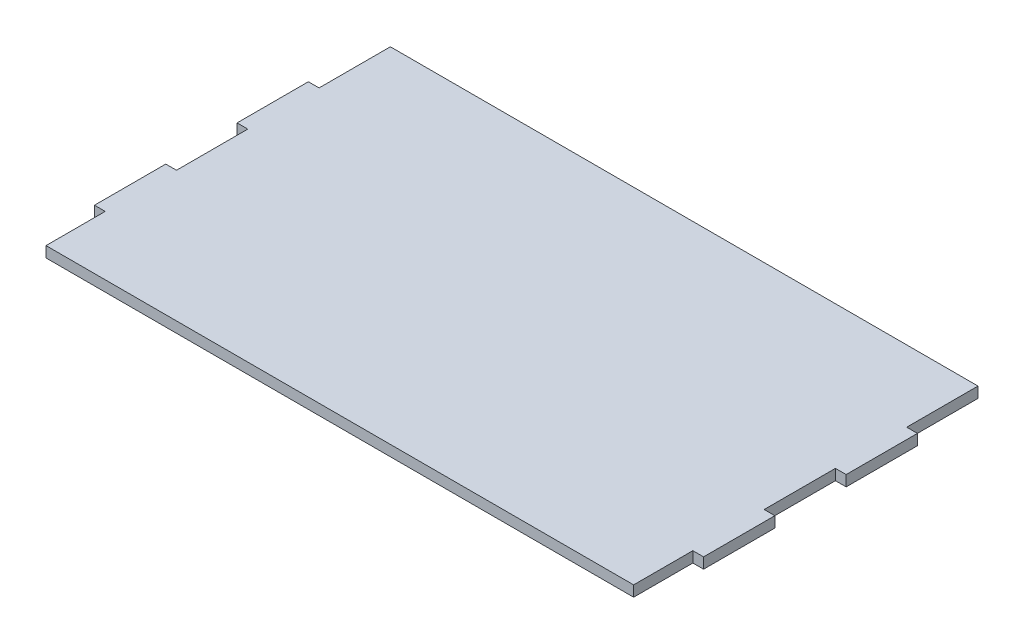
from build123d import *

# Parameters (mm, degrees)
BOSS_EXTRUDE1_DEPTH = 2.7


with BuildPart() as part:
    # Sketch2 → Boss-Extrude1 (new body)
    with BuildSketch(Plane(origin=(0, 0, 0), x_dir=(1, 0, 0), z_dir=(0, 1, 0))):
        Polygon((-76.7, -26.931), (-76.7, -8.977), (-74, -8.977), (-74, 8.977), (-76.7, 8.977), (-76.7, 26.931), (-74, 26.931), (-74, 44.885), (74, 44.885), (74, 26.931), (76.7, 26.931), (76.7, 8.977), (74, 8.977), (74, -8.977), (76.7, -8.977), (76.7, -26.931), (74, -26.931), (74, -41.845), (-74, -41.845), (-74, -26.931), align=None)
    extrude(amount=BOSS_EXTRUDE1_DEPTH)


solid = part.part
